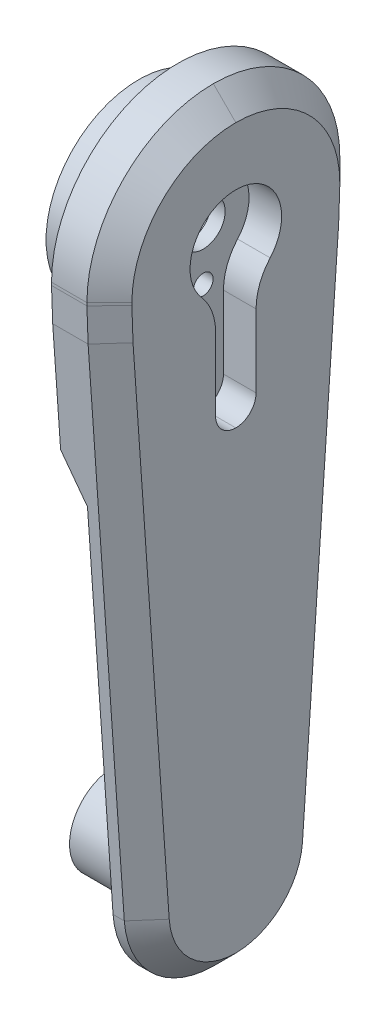
from build123d import *
from OCP.BRepFilletAPI import BRepFilletAPI_MakeChamfer

# Parameters (mm, degrees)
SKETCH1_W           = 20
SKETCH1_H           = 20
BOSS_EXTRUDE1_DEPTH = 20
SKETCH2_W           = 45
SKETCH2_H           = 70
BOSS_EXTRUDE2_DEPTH = 8.3
CUT_EXTRUDE1_DEPTH  = 5.8
FILLET1_R           = 3.6
FILLET2_R           = 10
SKETCH5_R           = 3.9
CUT_EXTRUDE2_DEPTH  = 51.320373608
CUT_EXTRUDE3_REACH  = 49.302
SKETCH6_R           = 1.75
SKETCH13_W          = 20
SKETCH13_H          = 20
CUT_EXTRUDE9_DEPTH  = 20
SKETCH14_R          = 16.475
BOSS_EXTRUDE3_DEPTH = 7.6
SKETCH15_W          = 8.3
SKETCH15_H          = 45
CUT_EXTRUDE10_DEPTH = 12.5
SKETCH16_R          = 13.475
CUT_EXTRUDE11_DEPTH = 7.6
SKETCH18_W          = 8.3
SKETCH18_H          = 45
BOSS_EXTRUDE4_DEPTH = 78.5
FILLET5_R           = 22.5
SKETCH20_W          = 45
SKETCH20_H          = 80
CUT_EXTRUDE12_DEPTH = 2.3
SKETCH21_R          = 8
BOSS_EXTRUDE5_DEPTH = 15.6
CHAMFER2_SIZE       = 110
CHAMFER2_SIZE2      = 7.691949314
CHAMFER3_SIZE       = 3
FILLET6_R           = 16
CHAMFER4_SIZE       = 4
SKETCH23_R          = 2.35
CUT_EXTRUDE13_DEPTH = 8
CHAMFER5_SIZE       = 1
SKETCH24_R          = 5
BOSS_EXTRUDE6_DEPTH = 7.6
SKETCH27_R          = 2.35
CUT_EXTRUDE14_DEPTH = 8
SKETCH28_R          = 16.475
SKETCH28_R_2        = 1.75
BOSS_EXTRUDE7_DEPTH = 2
BOSS_EXTRUDE8_START = 1.4
SKETCH30_R          = 16.475
SKETCH30_R_2        = 2.35
BOSS_EXTRUDE8_DEPTH = 1.4
FILLET7_R           = 2
FILLET8_R           = 1.5
CHAMFER6_SIZE       = 1
SKETCH31_R          = 3.05
CUT_EXTRUDE15_DEPTH = 2.3
FILLET9_R           = 1
CHAMFER7_SIZE2      = 4.3
CHAMFER7_SIZE       = 6.881438475


# Some blends are built 0.0001 mm under size
with BuildPart() as part:
    # Sketch1 → Boss-Extrude1 (new body)
    with BuildSketch(Plane(origin=(0, 0, 0), x_dir=(0, 0, -1), z_dir=(1, 0, 0))):
        Rectangle(SKETCH1_W, SKETCH1_H)
    extrude(amount=BOSS_EXTRUDE1_DEPTH)

    # Sketch2 → Boss-Extrude2 (add)
    with BuildSketch(Plane(origin=(20, 0, 0), x_dir=(0, 0, -1), z_dir=(1, 0, 0))):
        Rectangle(SKETCH2_W, SKETCH2_H)
    extrude(amount=BOSS_EXTRUDE2_DEPTH)

    # Sketch4 → Cut-Extrude1 (cut)
    with BuildSketch(Plane(origin=(28.3, 0, 0), x_dir=(0, 0, -1), z_dir=(1, 0, 0))):
        with BuildLine():
            Line((3.6, -28.55), (-3.6, -28.55))
            Line((-3.6, -28.55), (-3.6, -7.311805523))
            ThreePointArc((-3.6, -7.311805523), (0, 8.15), (3.6, -7.311805523))
            Line((3.6, -7.311805523), (3.6, -28.55))
        make_face()
    extrude(amount=-CUT_EXTRUDE1_DEPTH, mode=Mode.SUBTRACT)

    # Fillet1
    fillet1_edges = [part.edges().sort_by_distance(p)[0] for p in [
        (25.4, -28.55, 3.6),
        (25.4, -28.55, -3.6),
    ]]
    fillet(fillet1_edges, radius=FILLET1_R - 0.0001)  # a hair under: the kernel refuses the full size

    # Fillet2
    fillet2_edges = [part.edges().sort_by_distance(p)[0] for p in [
        (25.4, -7.311805523, 3.6),
        (25.4, -7.311805523, -3.6),
    ]]
    fillet(fillet2_edges, radius=FILLET2_R)

    # Sketch5 → Cut-Extrude2 (cut, through all)
    with BuildSketch(Plane.ZY):
        Circle(SKETCH5_R)
    extrude(amount=-CUT_EXTRUDE2_DEPTH, mode=Mode.SUBTRACT)

    # Sketch6 → Cut-Extrude3 (cut, up to next)
    with BuildSketch(Plane(origin=(22.5, 0, 0), x_dir=(0, 0, -1), z_dir=(1, 0, 0)), mode=Mode.PRIVATE) as cut_extrude3_sk1:
        with Locations((0, -20.6)):
            Circle(SKETCH6_R)
    cut_extrude3_tool1 = extrude(cut_extrude3_sk1.sketch, amount=-CUT_EXTRUDE3_REACH, mode=Mode.PRIVATE) & part.part
    # Sketch6 → Cut-Extrude3 (cut, up to next)
    with BuildSketch(Plane(origin=(22.5, 0, 0), x_dir=(0, 0, -1), z_dir=(1, 0, 0)), mode=Mode.PRIVATE) as cut_extrude3_sk2:
        with Locations((0, -9.35)):
            Circle(SKETCH6_R)
    cut_extrude3_tool2 = extrude(cut_extrude3_sk2.sketch, amount=-CUT_EXTRUDE3_REACH, mode=Mode.PRIVATE) & part.part
    add(cut_extrude3_tool1.solids().sort_by_distance((22.5, -20.6, 0))[0], mode=Mode.SUBTRACT)
    add(cut_extrude3_tool2.solids().sort_by_distance((22.5, -9.35, 0))[0], mode=Mode.SUBTRACT)

    # Sketch13 → Cut-Extrude9 (cut)
    with BuildSketch(Plane.ZY):
        Rectangle(SKETCH13_W, SKETCH13_H)
    extrude(amount=-CUT_EXTRUDE9_DEPTH, mode=Mode.SUBTRACT)

    # Sketch14 → Boss-Extrude3 (add)
    with BuildSketch(Plane.ZY.offset(-20)):
        with Locations(Location((0, 0, 0), (0, 0, 180))):
            Circle(SKETCH14_R)
    extrude(amount=BOSS_EXTRUDE3_DEPTH)

    # Sketch15 → Cut-Extrude10 (cut)
    with BuildSketch(Plane(origin=(0, 35, 0), x_dir=(1, 0, 0), z_dir=(0, 1, 0))):
        with Locations((24.15, 0)):
            Rectangle(SKETCH15_W, SKETCH15_H)
    extrude(amount=-CUT_EXTRUDE10_DEPTH, mode=Mode.SUBTRACT)

    # Sketch16 → Cut-Extrude11 (cut)
    with BuildSketch(Plane.ZY.offset(-12.4)):
        Circle(SKETCH16_R)
    extrude(amount=-CUT_EXTRUDE11_DEPTH, mode=Mode.SUBTRACT)

    # Sketch18 → Boss-Extrude4 (add)
    with BuildSketch(Plane.XZ.offset(35)):
        with Locations((24.15, 0)):
            Rectangle(SKETCH18_W, SKETCH18_H)
    extrude(amount=BOSS_EXTRUDE4_DEPTH)

    # Fillet5
    fillet5_edges = [part.edges().sort_by_distance(p)[0] for p in [
        (24.15, 22.5, -22.5),
        (24.15, 22.5, 22.5),
    ]]
    fillet(fillet5_edges, radius=FILLET5_R - 0.0001)  # a hair under: the kernel refuses the full size

    # Sketch20 → Cut-Extrude12 (cut)
    with BuildSketch(Plane.ZY.offset(-20)):
        with Locations((0, -73.5)):
            Rectangle(SKETCH20_W, SKETCH20_H)
    extrude(amount=-CUT_EXTRUDE12_DEPTH, mode=Mode.SUBTRACT)

    # Sketch21 → Boss-Extrude5 (add)
    with BuildSketch(Plane.ZY.offset(-22.3)):
        with Locations(Location((0, -99.5, 0), (0, 0, 180))):
            Circle(SKETCH21_R)
    extrude(amount=BOSS_EXTRUDE5_DEPTH)

    # Chamfer2: one chamfer whose edges measure the first distance from different faces: ONE call of the kernel's chamfer builder (chamfer() names one face for all edges)
    chamfer2_edges_1 = [part.edges().sort_by_distance(p)[0] for p in [
        (25.3, -113.5, -22.5),
    ]]
    chamfer2_side_1 = [part.faces().sort_by_distance(p)[0] for p in [
        (24.878183359, -52.68424744, -22.5),
    ]]
    chamfer2_edges_2 = [part.edges().sort_by_distance(p)[0] for p in [
        (25.3, -113.5, 22.5),
    ]]
    chamfer2_side_2 = [part.faces().sort_by_distance(p)[0] for p in [
        (24.878183359, -52.68424744, 22.5),
    ]]
    chamfer2 = BRepFilletAPI_MakeChamfer(part.part.solid().wrapped)
    for e in chamfer2_edges_1:
        chamfer2.Add(CHAMFER2_SIZE, CHAMFER2_SIZE2, e.wrapped, chamfer2_side_1[0].wrapped)  # the first distance lies on this face
    for e in chamfer2_edges_2:
        chamfer2.Add(CHAMFER2_SIZE, CHAMFER2_SIZE2, e.wrapped, chamfer2_side_2[0].wrapped)  # the first distance lies on this face
    add(Compound.cast(chamfer2.Shape()), mode=Mode.REPLACE)

    # Chamfer3
    # the kernel refuses this chamfer: 3 mm, written as the material it takes off along each edge
    with BuildSketch(Plane(origin=(36.099824275, -3.5, -22.5), x_dir=(0, -0.9976567869548854, 0.06841736214481542), z_dir=(-1, 0, 0))) as chamfer3_piece_1:
        Polygon((CHAMFER3_SIZE * 0.99999909909, CHAMFER3_SIZE * 0.00134231857559), (-CHAMFER3_SIZE * 0.997656786955, CHAMFER3_SIZE * 0.0684173621448), (0, 0), align=None)
    extrude(amount=23.89964855, mode=Mode.SUBTRACT)
    with BuildSketch(Plane(origin=(12.200175725, -3.5, 22.5), x_dir=(0, 0.999999099090015, 0.0013423185755924486), z_dir=(1, 0, 0))) as chamfer3_piece_2:
        Polygon((CHAMFER3_SIZE * 0.99999909909, -CHAMFER3_SIZE * 0.00134231857559), (-CHAMFER3_SIZE * 0.997656786955, -CHAMFER3_SIZE * 0.0684173621448), (0, 0), align=None)
    extrude(amount=23.89964855, mode=Mode.SUBTRACT)

    # Fillet6
    # the kernel refuses this fillet: 16 mm, written as the material it takes off along each edge
    with BuildSketch(Plane(origin=(65.600603446, -113.5, -14.808050686), x_dir=(0, 0, 1), z_dir=(-1, 0, 0))) as fillet6_piece_1:
        with BuildLine():
            CenterArc((FILLET6_R * 0.932515086138, FILLET6_R), FILLET6_R, 184, 86)
            Line((-FILLET6_R * 0.0650489641222, FILLET6_R * 0.930243526256), (0, 0))
            Line((0, 0), (FILLET6_R * 0.932515086138, 0))
        make_face()
    extrude(amount=80.601206891, mode=Mode.SUBTRACT)
    with BuildSketch(Plane(origin=(-15.000603446, -113.5, 14.808050686), x_dir=(0, 0.9975640502598242, 0.06975647374412544), z_dir=(1, 0, 0))) as fillet6_piece_2:
        with BuildLine():
            CenterArc((FILLET6_R * 0.932515086138, -FILLET6_R), FILLET6_R, 90, 86)
            Line((-FILLET6_R * 0.0650489641222, -FILLET6_R * 0.930243526256), (0, 0))
            Line((0, 0), (FILLET6_R * 0.932515086138, 0))
        make_face()
    extrude(amount=80.601206891, mode=Mode.SUBTRACT)

    # Chamfer4
    # the kernel refuses this chamfer: 4 mm, written as the material it takes off along each edge
    with BuildSketch(Plane(origin=(28.3, 0.0001, 22.5), x_dir=(0.02749587661058735, 0, -0.9996219169112968), z_dir=(0, -1, 0)), Plane(origin=(28.3, -10.786731952, -22.5), x_dir=(0.027495876610586487, 0, 0.9996219169112968), z_dir=(0, 1, 0))) as chamfer4_piece_1:
        Polygon((CHAMFER4_SIZE * 0.999621916911, -CHAMFER4_SIZE * 0.0274958766106), (-CHAMFER4_SIZE * 0.0274958766106, -CHAMFER4_SIZE * 0.999621916911), (0, 0), align=None)
    extrude(amount=10.786831952, mode=Mode.SUBTRACT)
    with BuildSketch(Plane(origin=(28.3, 0.0001, 0.0001), x_dir=(0, 1, 0), z_dir=(0, 0, -1))) as chamfer4_piece_2:
        Polygon((22.4999 - CHAMFER4_SIZE, 0), (22.4999, -CHAMFER4_SIZE), (22.4999, 0), align=None)
    revolve(axis=Axis((28.3, 0.0001, 0.0001), (1, 0, 0)), revolution_arc=90, mode=Mode.SUBTRACT)
    with BuildSketch(Plane(origin=(28.3, 0.0001, -0.0001), x_dir=(0, 0, -1), z_dir=(0, -1, 0))) as chamfer4_piece_3:
        Polygon((22.4999 - CHAMFER4_SIZE, 0), (22.4999, -CHAMFER4_SIZE), (22.4999, 0), align=None)
    revolve(axis=Axis((28.3, 0.0001, -0.0001), (1, 0, 0)), revolution_arc=90, mode=Mode.SUBTRACT)
    with BuildSketch(Plane(origin=(28.3, 3.768981839, 23.008296726), x_dir=(0.027495876610586473, 0.06973010000107531, -0.9971868881625227), z_dir=(0, -0.9975640502598243, -0.06975647374412554))) as chamfer4_piece_4:
        Polygon((CHAMFER4_SIZE * 0.999621916911, -CHAMFER4_SIZE * 0.0274958766106), (-CHAMFER4_SIZE * 0.0274958766106, -CHAMFER4_SIZE * 0.999621916911), (0, 0), align=None)
    extrude(amount=102.635099363, mode=Mode.SUBTRACT)
    with BuildSketch(Plane(origin=(28.3, 9.780465553, -22.859001768), x_dir=(0.027495876610586487, 0.03488630179317817, 0.9990129742483882), z_dir=(0, -0.9993908270190893, 0.03489949670268572))) as chamfer4_piece_5:
        Polygon((CHAMFER4_SIZE * 0.999621916911, CHAMFER4_SIZE * 0.0274958766106), (-CHAMFER4_SIZE * 0.0274958766106, CHAMFER4_SIZE * 0.999621916911), (0, 0), align=None)
    extrude(amount=26.569808866, mode=Mode.SUBTRACT)
    with BuildSketch(Plane(origin=(28.3, 9.780465553, 22.859001768), x_dir=(0.027495876610586494, 0.034886301793392936, -0.9990129742483806), z_dir=(0, -0.9993908270190818, -0.03489949670290056))) as chamfer4_piece_6:
        Polygon((CHAMFER4_SIZE * 0.999621916911, -CHAMFER4_SIZE * 0.0274958766106), (-CHAMFER4_SIZE * 0.0274958766106, -CHAMFER4_SIZE * 0.999621916911), (0, 0), align=None)
    extrude(amount=26.569808866, mode=Mode.SUBTRACT)
    with BuildSketch(Plane(origin=(28.3, 3.768981839, -23.008296726), x_dir=(0.027495876610586473, 0.06973010000107512, 0.9971868881625227), z_dir=(0, -0.9975640502598243, 0.06975647374412534))) as chamfer4_piece_7:
        Polygon((CHAMFER4_SIZE * 0.999621916911, CHAMFER4_SIZE * 0.0274958766106), (-CHAMFER4_SIZE * 0.0274958766106, CHAMFER4_SIZE * 0.999621916911), (0, 0), align=None)
    extrude(amount=102.635099363, mode=Mode.SUBTRACT)
    with BuildSketch(Plane(origin=(28.3, -97.5, -0.112190692), x_dir=(0, -0.9999754161991546, 0.007011918234514749), z_dir=(0, -0.007011918234514749, -0.9999754161991546))) as chamfer4_piece_8:
        Polygon((16 - CHAMFER4_SIZE, 0), (16, CHAMFER4_SIZE), (16, 0), align=None)
    revolve(axis=Axis((28.3, -97.5, -0.112190692), (-1, 0, 0)), revolution_arc=85.598243387, mode=Mode.SUBTRACT)
    with BuildSketch(Plane(origin=(28.3, -97.5, 0.112190692), x_dir=(0, -0.9999754161989443, -0.0070119182645099615), z_dir=(0, -0.0070119182645099615, 0.9999754161989443))) as chamfer4_piece_9:
        Polygon((16 - CHAMFER4_SIZE, 0), (16, -CHAMFER4_SIZE), (16, 0), align=None)
    revolve(axis=Axis((28.3, -97.5, 0.112190692), (1, 0, 0)), revolution_arc=85.598243385, mode=Mode.SUBTRACT)
    with BuildSketch(Plane(origin=(28.3, 22.5, -0.0001), x_dir=(0.027495876610588214, -0.9996219169112968, 0), z_dir=(0, 0, 1))) as chamfer4_piece_10:
        Polygon((CHAMFER4_SIZE * 0.999621916911, -CHAMFER4_SIZE * 0.0274958766106), (-CHAMFER4_SIZE * 0.0274958766106, -CHAMFER4_SIZE * 0.999621916911), (0, 0), align=None)
    extrude(amount=0.0002, mode=Mode.SUBTRACT)

    # Sketch23 → Cut-Extrude13 (cut)
    with BuildSketch(Plane.ZY.offset(-6.7)):
        with Locations((-4, -99.5)):
            Circle(SKETCH23_R)
        with Locations((4, -99.5)):
            Circle(SKETCH23_R)
    extrude(amount=-CUT_EXTRUDE13_DEPTH, mode=Mode.SUBTRACT)

    # Chamfer5
    chamfer5_edges = [part.edges().sort_by_distance(p)[0] for p in [
        (6.7, -99.5, 1.65),
        (6.7, -99.5, -6.35),
    ]]
    chamfer(chamfer5_edges, length=CHAMFER5_SIZE)

    # Sketch24 → Boss-Extrude6 (add)
    with BuildSketch(Plane.ZY.offset(-20)):
        with Locations((-11.225, 0)):
            Circle(SKETCH24_R)
        with Locations((11.225, 0)):
            Circle(SKETCH24_R)
    extrude(amount=BOSS_EXTRUDE6_DEPTH)

    # Sketch27 → Cut-Extrude14 (cut)
    with BuildSketch(Plane.ZY.offset(-12.4)):
        with Locations((-11.225, 0)):
            Circle(SKETCH27_R)
        with Locations(Location((11.225, 0, 0), (0, 0, 180))):
            Circle(SKETCH27_R)
    extrude(amount=-CUT_EXTRUDE14_DEPTH, mode=Mode.SUBTRACT)

    # Sketch28 → Boss-Extrude7 (add)
    with BuildSketch(Plane.ZY.offset(-20)):
        with BuildLine():
            Line((20.402195642, -33.5), (22.290730579, -6.492692151))
            Line((22.290730579, -6.492692151), (22.5, -0.5))
            Line((22.5, -0.5), (22.5, 0))
            ThreePointArc((22.5, 0), (15.909902577, 15.909902577), (0, 22.5))
            ThreePointArc((0, 22.5), (-15.909902577, 15.909902577), (-22.5, 0))
            Line((-22.5, 0), (-22.5, -0.5))
            Line((-22.5, -0.5), (-22.290730579, -6.492692151))
            Line((-22.290730579, -6.492692151), (-20.402195642, -33.5))
            Line((-20.402195642, -33.5), (20.402195642, -33.5))
        make_face()
        with Locations(Location((0, 0, 0), (0, 0, 180))):
            Circle(SKETCH28_R, mode=Mode.SUBTRACT)
        with Locations(Location((0, -20.6, 0), (0, 0, 180))):
            Circle(SKETCH28_R_2, mode=Mode.SUBTRACT)
    extrude(amount=BOSS_EXTRUDE7_DEPTH)

    # Sketch30 → Boss-Extrude8 (add)
    with BuildSketch(Plane.ZY.offset(-12.4).offset(BOSS_EXTRUDE8_START)):
        with Locations(Location((0, 0, 0), (0, 0, 180))):
            Circle(SKETCH30_R)
        with Locations((-11.225, 0)):
            Circle(SKETCH30_R_2, mode=Mode.SUBTRACT)
        with Locations((11.225, 0)):
            Circle(SKETCH30_R_2, mode=Mode.SUBTRACT)
        with BuildLine():
            ThreePointArc((12.586915367, 4.810944453), (0, 13.475), (-12.586915367, 4.810944453))
            ThreePointArc((-12.586915367, 4.810944453), (-6.225, 0), (-12.586915367, -4.810944453))
            ThreePointArc((-12.586915367, -4.810944453), (0, -13.475), (12.586915367, -4.810944453))
            ThreePointArc((12.586915367, -4.810944453), (6.225, 0), (12.586915367, 4.810944453))
        make_face(mode=Mode.SUBTRACT)
    extrude(amount=-BOSS_EXTRUDE8_DEPTH)

    # Fillet7
    fillet7_edges = [part.edges().sort_by_distance(p)[0] for p in [
        (16.2, -4.810944453, 12.586915367),
        (16.2, 4.810944453, 12.586915367),
        (15.5, 4.810944453, -12.586915367),
        (15.5, -4.810944453, -12.586915367),
    ]]
    fillet(fillet7_edges, radius=FILLET7_R)

    # Fillet8
    fillet8_edges = [part.edges().sort_by_distance(p)[0] for p in [
        (20, 0, 6.225),
        (20, -13.475, 0),
        (20, 13.475, 0),
        (20, 0, -6.225),
        (20, -6.075999698, -11.185646156),
        (20, 6.075999698, -11.185646156),
        (20, 6.075999698, 11.185646156),
        (20, -6.075999698, 11.185646156),
    ]]
    fillet(fillet8_edges, radius=FILLET8_R)

    # Chamfer6
    chamfer6_edges = [part.edges().sort_by_distance(p)[0] for p in [
        (11, 0, -13.575),
        (11, 0, 8.875),
    ]]
    chamfer(chamfer6_edges, length=CHAMFER6_SIZE)

    # Sketch31 → Cut-Extrude15 (cut)
    with BuildSketch(Plane.ZY.offset(-18)):
        with Locations((0, -20.6)):
            Circle(SKETCH31_R)
    extrude(amount=-CUT_EXTRUDE15_DEPTH, mode=Mode.SUBTRACT)

    # Fillet9
    fillet9_edges = [part.edges().sort_by_distance(p)[0] for p in [
        (18, -20.6, -3.05),
    ]]
    fillet(fillet9_edges, radius=FILLET9_R)

    # Chamfer7
    chamfer7_edges = [part.edges().sort_by_distance(p)[0] for p in [
        (18, -33.5, 0),
    ]]
    chamfer7_side = [part.faces().sort_by_distance(p)[0] for p in [
        (18, -33.414, 0),
    ]]
    chamfer(chamfer7_edges, length=CHAMFER7_SIZE - 0.0001, length2=CHAMFER7_SIZE2 - 0.0001, reference=chamfer7_side[0])  # a hair under: the kernel refuses the full size


solid = part.part
